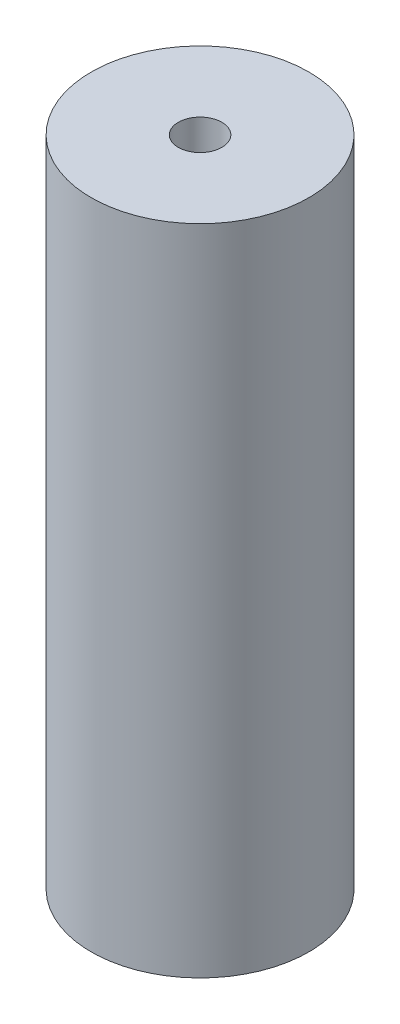
from build123d import *


with BuildPart() as part:
    # Sketch1 → Revolve1 (revolve)
    with BuildSketch(Plane.XY):
        Polygon((-0.5, 15), (-0.5, 5), (-1.4, 5), (-1.4, 0), (-2.5, 0), (-2.5, 15), align=None)
    revolve(axis=Axis((0, 0, 0), (0, 1, 0)))


solid = part.part
